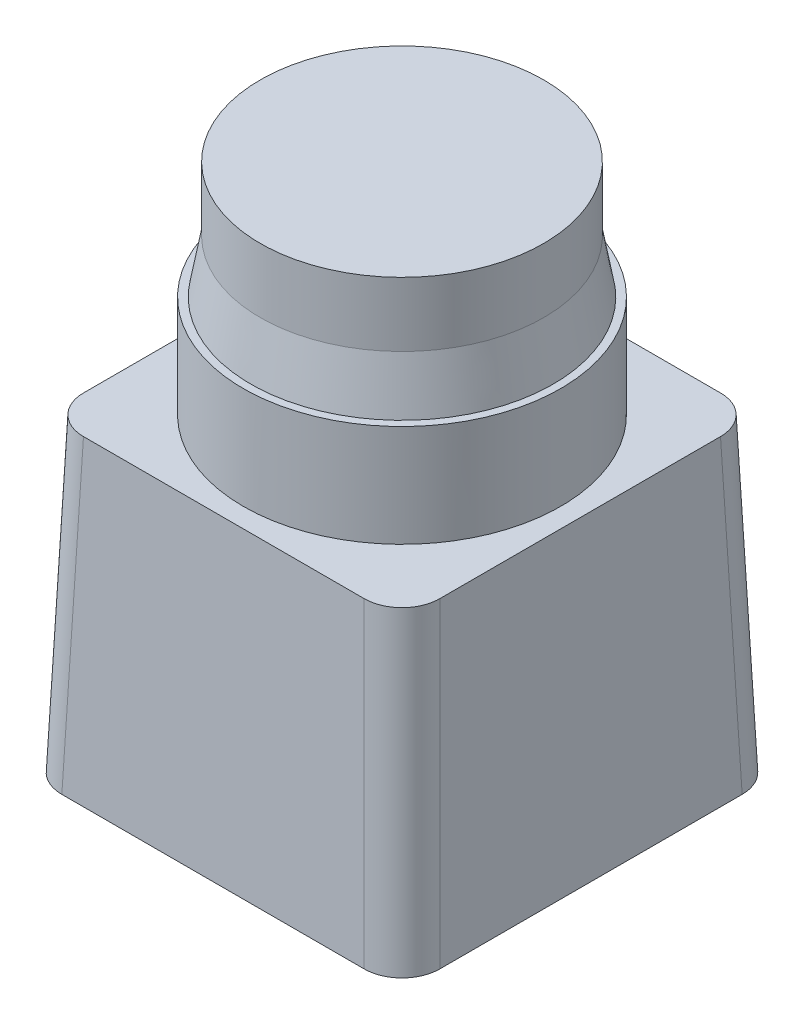
from build123d import *

# Parameters (mm, degrees)
ESBO_O1_W                = 50
ESBO_O1_H                = 50
RESSALTO_EXTRUS_O1_DEPTH = 41
RESSALTO_EXTRUS_O1_TAPER = 2
FILETE1_R                = 5
ESBO_O3_R                = 1.25
CORTE_EXTRUS_O1_DEPTH    = 6


with BuildPart() as part:
    # Esboço1 → Ressalto-extrusão1 (new body)
    with BuildSketch(Plane(origin=(0, 0, 0), x_dir=(1, 0, 0), z_dir=(0, 1, 0))):
        Rectangle(ESBO_O1_W, ESBO_O1_H)
    extrude(amount=RESSALTO_EXTRUS_O1_DEPTH, taper=RESSALTO_EXTRUS_O1_TAPER)

    # Esboço2 → Revolução1 (revolve)
    with BuildSketch(Plane(origin=(0, 0, 0), x_dir=(0, 0, -1), z_dir=(1, 0, 0))):
        Polygon((0, 70), (0, 41), (21, 41), (21, 54.5), (20, 54.5), (18.75, 61.5), (18.75, 70), align=None)
    revolve(axis=Axis((0, 41, 0), (0, 1, 0)))

    # Filete1
    filete1_edges = [part.edges().sort_by_distance(p)[0] for p in [
        (-24.284124225, 20.5, 24.284124225),
        (-24.284124225, 20.5, -24.284124225),
        (24.284124225, 20.5, 24.284124225),
        (24.284124225, 20.5, -24.284124225),
    ]]
    fillet(filete1_edges, radius=FILETE1_R)

    # Esboço3 → Corte-extrusão1 (cut)
    with BuildSketch(Plane(origin=(0, 0, 0), x_dir=(-1, 0, 0), z_dir=(0, -1, 0))):
        with Locations((20, 20.625)):
            Circle(ESBO_O3_R)
        with Locations((-20, -19.375)):
            Circle(ESBO_O3_R)
    extrude(amount=-CORTE_EXTRUS_O1_DEPTH, mode=Mode.SUBTRACT)


solid = part.part
